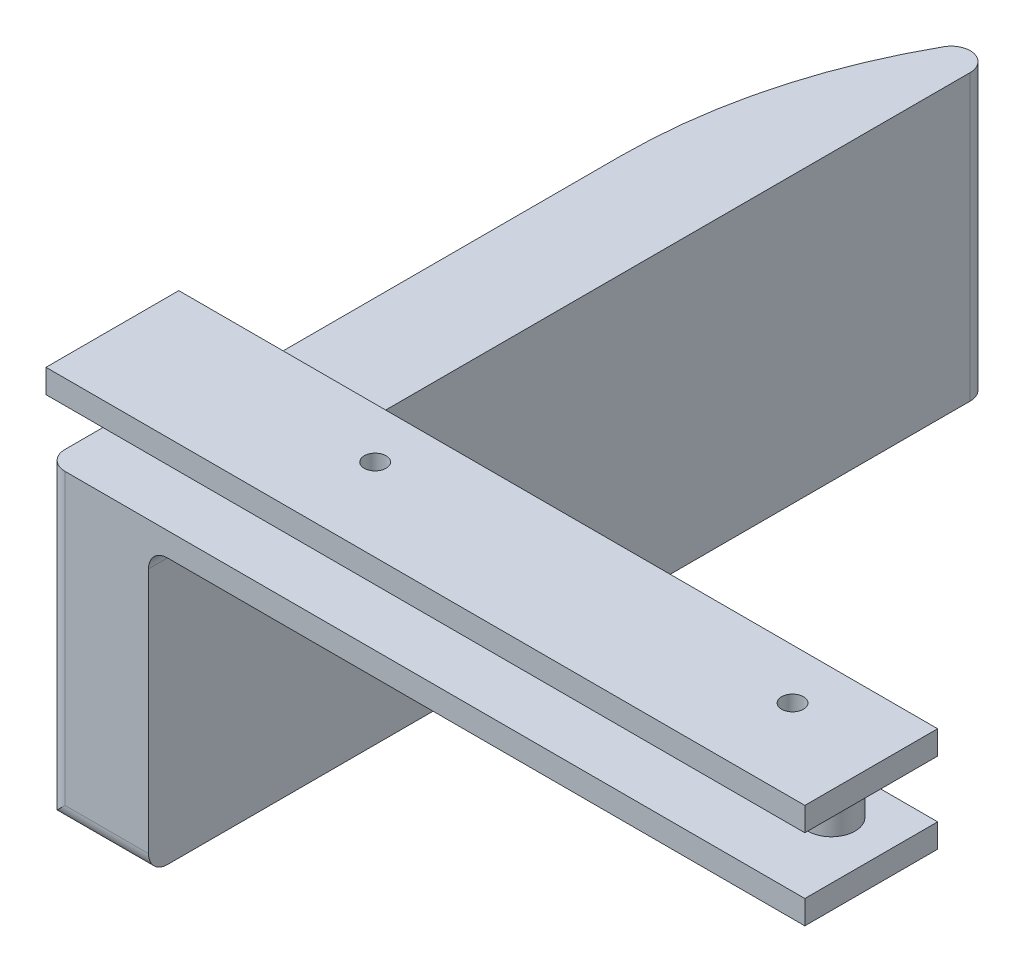
from build123d import *

# Parameters (mm, degrees)
SKETCH2_W           = 101.6
SKETCH2_H           = 17.78
BOSS_EXTRUDE1_DEPTH = 3.175
BOSS_EXTRUDE2_DEPTH = 7.62
BOSS_EXTRUDE3_DEPTH = 38.1
FILLET2_R           = 2.54
FILLET3_R           = 2.54
SKETCH6_R           = 1.4605
CUT_EXTRUDE1_DEPTH  = 161.318129994


with BuildPart() as part:
    # Sketch2 → Boss-Extrude1 (new body)
    with BuildSketch(Plane(origin=(0, 0, 0), x_dir=(1, 0, 0), z_dir=(0, 1, 0))):
        with Locations((50.8, 8.89)):
            Rectangle(SKETCH2_W, SKETCH2_H)
    boss_extrude1 = extrude(amount=BOSS_EXTRUDE1_DEPTH)

    # Sketch3 → Boss-Extrude2 (add)
    with BuildSketch(Plane.XZ):
        with BuildLine():
            Line((93.98, -14.351), (5.08, -14.351))
            ThreePointArc((5.08, -14.351), (1.905, -11.176), (5.08, -8.001))
            Line((5.08, -8.001), (93.98, -8.001))
            ThreePointArc((93.98, -8.001), (97.155, -11.176), (93.98, -14.351))
        make_face()
    extrude(amount=BOSS_EXTRUDE2_DEPTH)

    # Mirror1: Boss-Extrude1 across plane
    add(boss_extrude1.mirror(Plane(origin=(0, -3.81, 0), x_dir=(0, 0, 1), z_dir=(0, -1, 0))))

    # Sketch5 → Boss-Extrude3 (add)
    with BuildSketch(Plane.XZ.offset(10.795)):
        with BuildLine():
            Line((0, 0), (13.724447784, 0))
            Line((13.724447784, 0), (13.724447784, -118.618))
            ThreePointArc((13.724447784, -118.618), (3.519309988, -98.867872234), (0, -76.917317766))
            Line((0, -76.917317766), (0, 0))
        make_face()
    extrude(amount=BOSS_EXTRUDE3_DEPTH)

    # Fillet2
    fillet2_edges = [part.edges().sort_by_distance(p)[0] for p in [
        (13.724447784, -29.845, -118.618),
    ]]
    fillet(fillet2_edges, radius=FILLET2_R)

    # Fillet3
    # the kernel refuses this fillet: 2.54 mm, written as the material it adds along each edge
    with BuildSketch(Plane(origin=(13.724447784, -10.795, 0), x_dir=(0, -1, 0), z_dir=(0, 0, -1))) as fillet3_piece_1:
        with BuildLine():
            CenterArc((FILLET3_R, -FILLET3_R), FILLET3_R, 90, 90)
            Line((0, -FILLET3_R), (0, 0))
            Line((0, 0), (FILLET3_R, 0))
        make_face()
    extrude(amount=17.78)
    # the kernel refuses this fillet: 2.54 mm, written as the material it takes off along each edge
    with BuildSketch(Plane(origin=(0, -1.27, 0), x_dir=(0, 0, -1), z_dir=(0, -1, 0))) as fillet3_2_piece_1:
        with BuildLine():
            CenterArc((FILLET3_R, FILLET3_R), FILLET3_R, 180, 90)
            Line((0, FILLET3_R), (0, 0))
            Line((0, 0), (FILLET3_R, 0))
        make_face()
    extrude(amount=53.975, mode=Mode.SUBTRACT)
    with BuildSketch(Plane(origin=(-6.35, -48.895, 0), x_dir=(0, 0, -1), z_dir=(1, 0, 0))) as fillet3_2_piece_2:
        with BuildLine():
            CenterArc((FILLET3_R, FILLET3_R), FILLET3_R, 180, 90)
            Line((0, FILLET3_R), (0, 0))
            Line((0, 0), (FILLET3_R, 0))
        make_face()
    extrude(amount=26.424447784, mode=Mode.SUBTRACT)

    # Sketch6 → Cut-Extrude1 (cut, through all)
    with BuildSketch(Plane(origin=(0, 3.175, 0), x_dir=(1, 0, 0), z_dir=(0, 1, 0))):
        with Locations(Location((88.9, 11.049, 0), (0, 0, 270))):
            Circle(SKETCH6_R)
        with Locations(Location((33.02, 11.049, 0), (0, 0, 270))):
            Circle(SKETCH6_R)
    extrude(amount=-CUT_EXTRUDE1_DEPTH, mode=Mode.SUBTRACT)


solid = part.part
